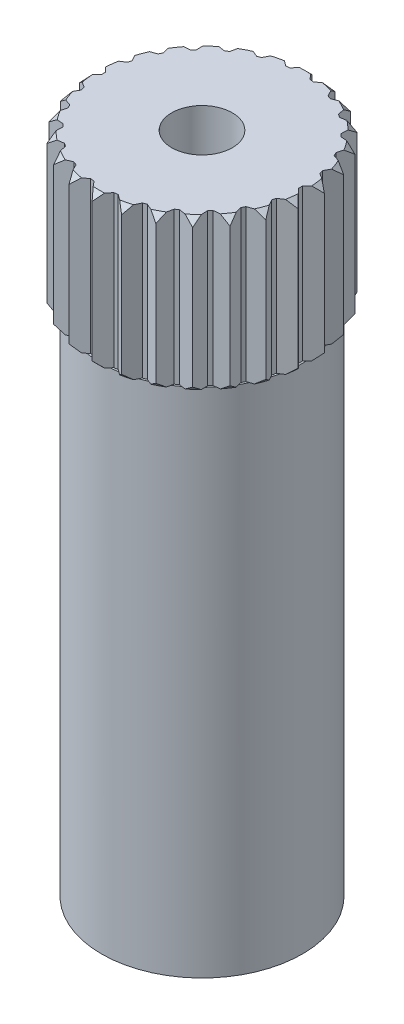
from build123d import *

# Parameters (mm, degrees)
SKETCH12_R          = 2.9
BOSS_EXTRUDE4_DEPTH = 13.5
SKETCH13_R          = 2.6
BOSS_EXTRUDE5_DEPTH = 4
BOSS_EXTRUDE6_REACH = 19.974
CIRPATTERN1_COUNT   = 26
SKETCH16_R          = 0.8
CUT_EXTRUDE1_DEPTH  = 4
SKETCH17_W          = 0.25
SKETCH17_H          = 13.5


with BuildPart() as part:
    # Sketch12 → Boss-Extrude4 (new body)
    with BuildSketch(Plane(origin=(0, 0, 0), x_dir=(1, 0, 0), z_dir=(0, 1, 0))):
        Circle(SKETCH12_R)
    extrude(amount=BOSS_EXTRUDE4_DEPTH)

    # Sketch13 → Boss-Extrude5 (add)
    with BuildSketch(Plane(origin=(0, 13.5, 0), x_dir=(1, 0, 0), z_dir=(0, 1, 0))):
        Circle(SKETCH13_R)
    extrude(amount=BOSS_EXTRUDE5_DEPTH)

    # Sketch14 → Boss-Extrude6 (add, up to next)
    with BuildSketch(Plane(origin=(0, 17.5, 0), x_dir=(1, 0, 0), z_dir=(0, 1, 0)), mode=Mode.PRIVATE) as boss_extrude6_sk1:
        with BuildLine():
            Line((0, 2.9), (-0.262912611, 2.586672952))
            ThreePointArc((-0.262912611, 2.586672952), (0, 2.6), (0.262912611, 2.586672952))
            Line((0.262912611, 2.586672952), (0, 2.9))
        make_face()
    boss_extrude6_tool1 = extrude(boss_extrude6_sk1.sketch, amount=-BOSS_EXTRUDE6_REACH, mode=Mode.PRIVATE) - part.part
    boss_extrude6 = boss_extrude6_tool1.solids().sort_by_distance((0, 17.5, -2.697077))[0]
    add(boss_extrude6)

    # CirPattern1: Boss-Extrude6 ×26 about axis
    cirpattern1_axis = Axis((0, 17.5, 0), (0, -1, 0))
    for i in range(1, CIRPATTERN1_COUNT):
        add(boss_extrude6.rotate(cirpattern1_axis, i * 360 / CIRPATTERN1_COUNT))

    # Sketch15 → Cut-Revolve1 (revolve, cut)
    with BuildSketch(Plane(origin=(0, 0, 0), x_dir=(0, 0, -1), z_dir=(1, 0, 0))):
        Polygon((2.9, 17.323223305), (2.9, 17.5), (2.723223305, 17.5), align=None)
    cut_revolve1 = revolve(axis=Axis((0, 17.5, 0), (0, -1, 0)), mode=Mode.SUBTRACT)

    # Sketch16 → Cut-Extrude1 (cut)
    with BuildSketch(Plane(origin=(0, 17.5, 0), x_dir=(1, 0, 0), z_dir=(0, 1, 0))):
        Circle(SKETCH16_R)
    extrude(amount=-CUT_EXTRUDE1_DEPTH, mode=Mode.SUBTRACT)

    # Sketch17 → Cut-Revolve2 (revolve, cut)
    with BuildSketch(Plane.XY):
        with Locations((2.775, 6.75)):
            Rectangle(SKETCH17_W, SKETCH17_H)
    revolve(axis=Axis((0, 13.5, 0), (0, -1, 0)), mode=Mode.SUBTRACT)

    # Mirror1: Cut-Revolve1 across plane
    add(cut_revolve1.mirror(Plane.ZX.offset(15.5)), mode=Mode.SUBTRACT)


solid = part.part
